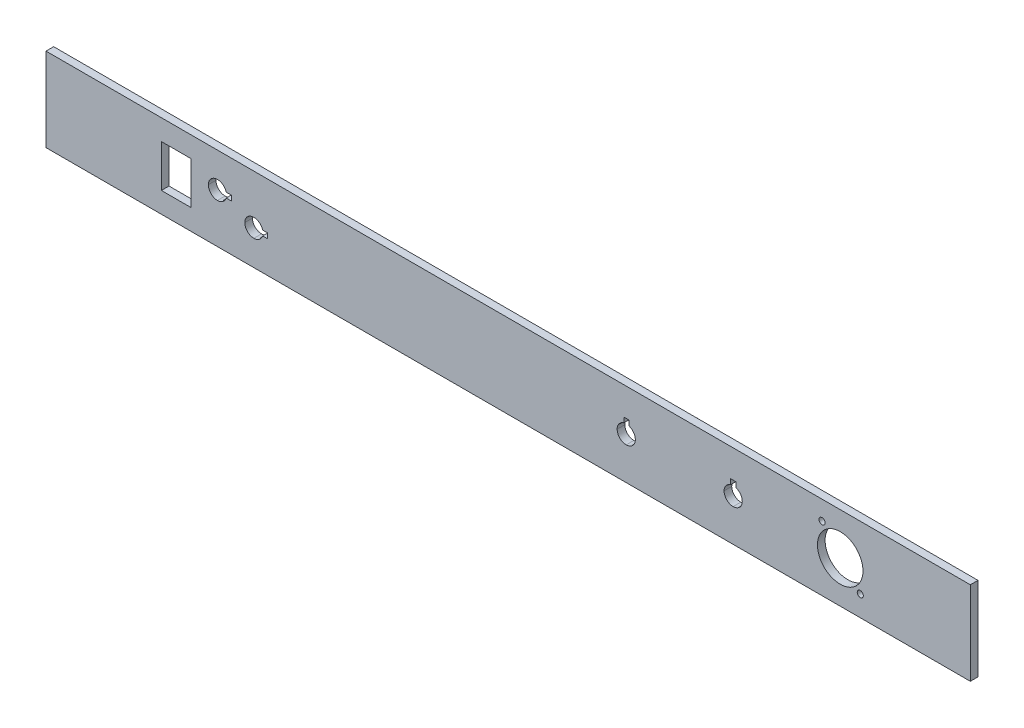
from build123d import *

# Parameters (mm, degrees)
SKETCH1_W           = 483
SKETCH1_H           = 43.7
BOSS_EXTRUDE1_DEPTH = 4
SKETCH2_R           = 11.9
SKETCH2_R_2         = 1.6
SKETCH2_W           = 15.417359221
SKETCH2_H           = 22.13620668
CUT_EXTRUDE1_DEPTH  = 4


with BuildPart() as part:
    # Sketch1 → Boss-Extrude1 (new body)
    with BuildSketch(Plane.XY):
        Rectangle(SKETCH1_W, SKETCH1_H)
    extrude(amount=BOSS_EXTRUDE1_DEPTH)

    # Sketch2 → Cut-Extrude1 (cut)
    with BuildSketch(Plane.XY.offset(4)):
        with Locations((173.5, 0)):
            Circle(SKETCH2_R)
        with Locations((183.993165462, -11.1)):
            Circle(SKETCH2_R_2)
        with Locations((163.993165462, 11.9)):
            Circle(SKETCH2_R_2)
        with Locations((-173.499204599, 0)):
            Rectangle(SKETCH2_W, SKETCH2_H)
        with BuildLine():
            Line((-147.368336195, 2.432488674), (-144.689048868, 2.432488674))
            Line((-144.689048868, 2.432488674), (-144.689048868, 5.074570565))
            Line((-144.689048868, 5.074570565), (-147.340430347, 5.074570565))
            add(Edge.make_bspline(
                [(-147.340430347, 5.074570565), (-147.89691412, 7.077712341), (-149.73708461, 8.553930632), (-151.917534978, 8.553930632)],
                knots=[0, 0, 0, 0, 1, 1, 1, 1], degree=3))
            add(Edge.make_bspline(
                [(-151.917534978, 8.553930632), (-154.539090466, 8.553930632), (-156.66209241, 6.430925145), (-156.66209241, 3.809348401)],
                knots=[0, 0, 0, 0, 1, 1, 1, 1], degree=3))
            add(Edge.make_bspline(
                [(-156.66209241, 3.809348401), (-156.66209241, 1.187778743), (-154.539090466, -0.944533418), (-151.917534978, -0.944533418)],
                knots=[0, 0, 0, 0, 1, 1, 1, 1], degree=3))
            add(Edge.make_bspline(
                [(-151.917534978, -0.944533418), (-149.774105825, -0.944533418), (-147.957862731, 0.481417503), (-147.368336195, 2.432488674)],
                knots=[0, 0, 0, 0, 1, 1, 1, 1], degree=3))
        make_face()
        with BuildLine():
            Line((-128.321601275, -5.186204585), (-125.642313949, -5.186204585))
            Line((-125.642313949, -5.186204585), (-125.642313949, -2.544122694))
            Line((-125.642313949, -2.544122694), (-128.293691885, -2.544122694))
            add(Edge.make_bspline(
                [(-128.293691885, -2.544122694), (-128.850175658, -0.540980918), (-130.690349691, 0.935237373), (-132.870800059, 0.935237373)],
                knots=[0, 0, 0, 0, 1, 1, 1, 1], degree=3))
            add(Edge.make_bspline(
                [(-132.870800059, 0.935237373), (-135.492355547, 0.935237373), (-137.615353949, -1.187768114), (-137.615353949, -3.809344858)],
                knots=[0, 0, 0, 0, 1, 1, 1, 1], degree=3))
            add(Edge.make_bspline(
                [(-137.615353949, -3.809344858), (-137.615353949, -6.430914517), (-135.492355547, -8.56323022), (-132.870800059, -8.56323022)],
                knots=[0, 0, 0, 0, 1, 1, 1, 1], degree=3))
            add(Edge.make_bspline(
                [(-132.870800059, -8.56323022), (-130.727370906, -8.56323022), (-128.911127812, -7.137279299), (-128.321601275, -5.186204585)],
                knots=[0, 0, 0, 0, 1, 1, 1, 1], degree=3))
        make_face()
        with BuildLine():
            Line((118.941040946, 7.22848611), (116.298959054, 7.22848611))
            Line((116.298959054, 7.22848611), (116.298959054, 4.577108174))
            add(Edge.make_bspline(
                [(116.298959054, 4.577108174), (114.295817279, 4.020624401), (112.819598988, 2.180450368), (112.819598988, 0)],
                knots=[0, 0, 0, 0, 1, 1, 1, 1], degree=3))
            add(Edge.make_bspline(
                [(112.819598988, 0), (112.819598988, -2.621555488), (114.942604475, -4.74455389), (117.564181219, -4.74455389)],
                knots=[0, 0, 0, 0, 1, 1, 1, 1], degree=3))
            add(Edge.make_bspline(
                [(117.564181219, -4.74455389), (120.185750877, -4.74455389), (122.31806658, -2.621555488), (122.31806658, 0)],
                knots=[0, 0, 0, 0, 1, 1, 1, 1], degree=3))
            add(Edge.make_bspline(
                [(122.31806658, 0), (122.31806658, 2.143429153), (120.892115659, 3.959672247), (118.941040946, 4.549198783)],
                knots=[0, 0, 0, 0, 1, 1, 1, 1], degree=3))
            Line((118.941040946, 4.549198783), (118.941040946, 7.22848611))
        make_face()
        with BuildLine():
            Line((63.061040946, 7.22848611), (60.418959054, 7.22848611))
            Line((60.418959054, 7.22848611), (60.418959054, 4.577108174))
            add(Edge.make_bspline(
                [(60.418959054, 4.577108174), (58.415817279, 4.020624401), (56.939598988, 2.180450368), (56.939598988, 0)],
                knots=[0, 0, 0, 0, 1, 1, 1, 1], degree=3))
            add(Edge.make_bspline(
                [(56.939598988, 0), (56.939598988, -2.621555488), (59.062604475, -4.74455389), (61.684181219, -4.74455389)],
                knots=[0, 0, 0, 0, 1, 1, 1, 1], degree=3))
            add(Edge.make_bspline(
                [(61.684181219, -4.74455389), (64.305750877, -4.74455389), (66.43806658, -2.621555488), (66.43806658, 0)],
                knots=[0, 0, 0, 0, 1, 1, 1, 1], degree=3))
            add(Edge.make_bspline(
                [(66.43806658, 0), (66.43806658, 2.143429153), (65.012115659, 3.959672247), (63.061040946, 4.549198783)],
                knots=[0, 0, 0, 0, 1, 1, 1, 1], degree=3))
            Line((63.061040946, 4.549198783), (63.061040946, 7.22848611))
        make_face()
    extrude(amount=-CUT_EXTRUDE1_DEPTH, mode=Mode.SUBTRACT)


solid = part.part
